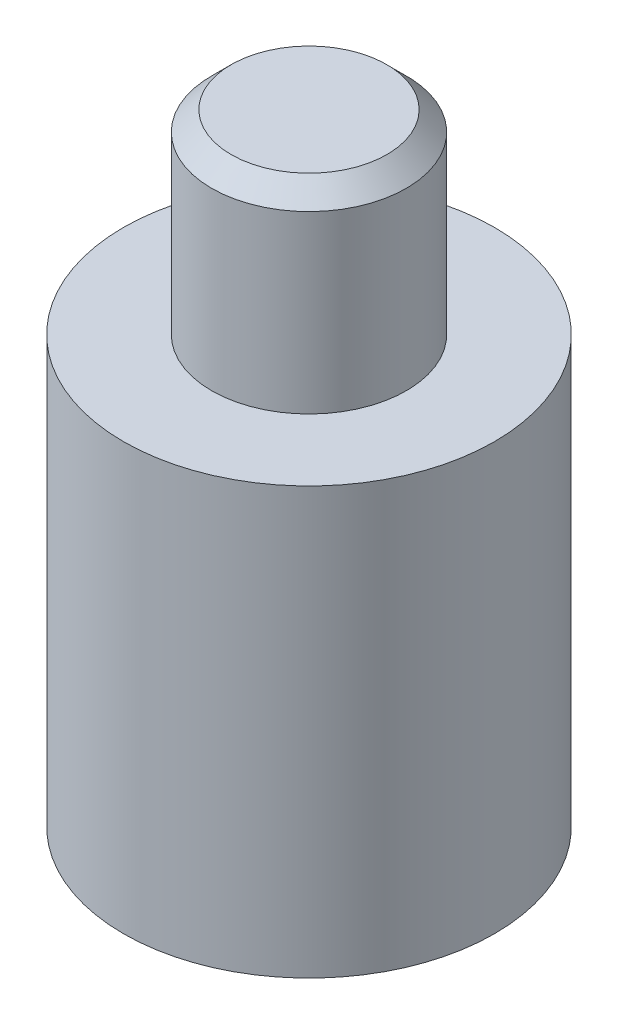
from build123d import *

# Parameters (mm, degrees)
SKETCH1_R           = 4.7625
SKETCH1_R_2         = 1.5
BOSS_EXTRUDE1_DEPTH = 10.94094
SKETCH2_R           = 2.5
BOSS_EXTRUDE2_DEPTH = 5
SKETCH1_3_R         = 1.5
CUT_EXTRUDE1_DEPTH  = 5
CHAMFER1_SIZE       = 0.5
THREAD1_PITCH       = 0.5


with BuildPart() as part:
    # Sketch1 → Boss-Extrude1 (new body)
    # profile 1 of 2: a face of its own
    with BuildSketch(Plane(origin=(0, 0, 0), x_dir=(1, 0, 0), z_dir=(0, 1, 0))):
        with Locations(Location((0, 0, 0), (0, 0, 90))):
            Circle(SKETCH1_R)
        Circle(SKETCH1_R_2, mode=Mode.SUBTRACT)
    # profile 2 of 2: a face of its own
    with BuildSketch(Plane(origin=(0, 0, 0), x_dir=(1, 0, 0), z_dir=(0, 1, 0))):
        Circle(SKETCH1_R_2)
    extrude(amount=BOSS_EXTRUDE1_DEPTH)

    # Sketch2 → Boss-Extrude2 (add)
    with BuildSketch(Plane(origin=(0, 10.94094, 0), x_dir=(1, 0, 0), z_dir=(0, 1, 0))):
        with Locations(Location((0, 0, 0), (0, 0, 270))):
            Circle(SKETCH2_R)
    extrude(amount=BOSS_EXTRUDE2_DEPTH)

    # Sketch1<3> → Cut-Extrude1 (cut)
    with BuildSketch(Plane(origin=(0, 0, 0), x_dir=(1, 0, 0), z_dir=(0, 1, 0))):
        with Locations(Location((0, 0, 0), (0, 0, 270))):
            Circle(SKETCH1_3_R)
    extrude(amount=CUT_EXTRUDE1_DEPTH, mode=Mode.SUBTRACT)

    # Chamfer1
    chamfer1_edges = [part.edges().sort_by_distance(p)[0] for p in [
        (0, 15.94094, -2.5),
    ]]
    chamfer(chamfer1_edges, length=CHAMFER1_SIZE)

    # Thread1: the profile of Thread Profile1 profile screwed along a right-hand helix of 10 turns, 6 arcs to a turn; built about Z, then put on its axis
    thread1_z = Axis((0, 0, 0), (0, 0, 1))
    thread1_corners = [(1.5003, 0, -0.000173205), (1.5003, 0, 0.437673204), (1.229367063, 0, 0.281249999), (1.229367063, 0, 0.156249999)]
    with BuildLine(mode=Mode.PRIVATE) as thread1_profile:
        Line(thread1_corners[0], thread1_corners[1])
        Line(thread1_corners[1], thread1_corners[2])
        Line(thread1_corners[2], thread1_corners[3])
        Line(thread1_corners[3], thread1_corners[0])
    thread1_cap = Face(thread1_profile.wire())
    thread1_turn_angles = [0, 30, 60, 90, 120, 150, 180, 210, 240, 270, 300, 330, 360]
    thread1_turn_weights = [1, 0.8660254037844387, 1, 0.8660254037844387, 1, 0.8660254037844387, 1, 0.8660254037844387, 1, 0.8660254037844387, 1, 0.8660254037844387, 1]
    thread1_turn_rails = [Edge.make_bspline([Vector(p[0], p[1], 0).rotate(thread1_z, thread1_turn_angles[k]) / thread1_turn_weights[k] + Vector(0, 0, p[2] + THREAD1_PITCH * thread1_turn_angles[k] / 360) for k in range(13)], [0, 0, 0, 1, 1, 2, 2, 3, 3, 4, 4, 5, 5, 6, 6, 6], 2, thread1_turn_weights) for p in thread1_corners]
    thread1_turn_sides = [Face.make_surface_from_curves(thread1_turn_rails[p[0]], thread1_turn_rails[p[1]]) for p in [(0, 1), (1, 2), (2, 3), (3, 0)]]
    thread1 = Plane(origin=(0, 0, 0), x_dir=(1, 0, 0), z_dir=(0, 1, 0)) * Solid(Shell([*[p.moved(Location((0, 0, THREAD1_PITCH * i))) for i in range(10) for p in thread1_turn_sides], thread1_cap, thread1_cap.rotate(thread1_z, 3600).moved(Location((0, 0, THREAD1_PITCH * 3600 / 360)))]))
    add(thread1)


solid = part.part
